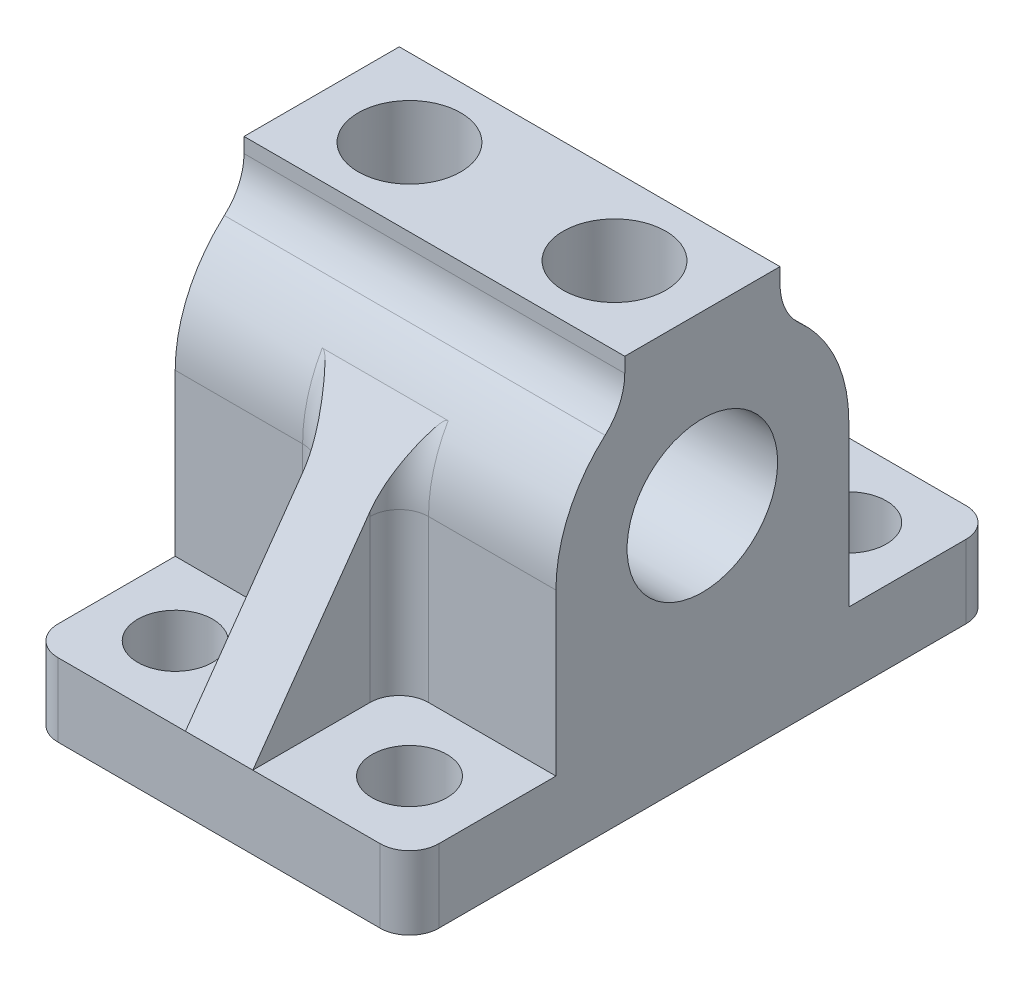
from build123d import *

# Parameters (mm, degrees)
SKETCH1_R           = 3.2639
BOSS_EXTRUDE1_DEPTH = 8.255
BOSS_EXTRUDE2_DEPTH = 1.4605
SKETCH3_R           = 1.6256
CUT_EXTRUDE1_DEPTH  = 21.180615699
CUT_EXTRUDE2_DEPTH  = 42.211451079
SKETCH6_W           = 16.51
SKETCH6_H           = 6.731
BOSS_EXTRUDE3_DEPTH = 1.905
SKETCH5_R           = 2.2225
CUT_EXTRUDE3_DEPTH  = 6.35
FILLET1_R           = 1.27
FILLET2_R           = 2.54


with BuildPart() as part:
    # Sketch1 → Boss-Extrude1 (new, symmetric)
    with BuildSketch(Plane(origin=(0, 0, 0), x_dir=(0, 0, -1), z_dir=(1, 0, 0))):
        with BuildLine():
            Line((12.7, 19.05), (-12.7, 19.05))
            Line((-12.7, 19.05), (-12.7, 22.225))
            Line((-12.7, 22.225), (-6.35, 22.225))
            Line((-6.35, 22.225), (-6.35, 29.21))
            ThreePointArc((-6.35, 29.21), (0, 35.56), (6.35, 29.21))
            Line((6.35, 29.21), (6.35, 22.225))
            Line((6.35, 22.225), (12.7, 22.225))
            Line((12.7, 22.225), (12.7, 19.05))
        make_face()
        with Locations((0, 29.21)):
            Circle(SKETCH1_R, mode=Mode.SUBTRACT)
    extrude(amount=BOSS_EXTRUDE1_DEPTH, both=True)

    # Sketch2 → Boss-Extrude2 (add, symmetric)
    with BuildSketch(Plane(origin=(0, 0, 0), x_dir=(0, 0, -1), z_dir=(1, 0, 0))):
        Polygon((-5.499261314, 32.385), (-12.7, 22.225), (-5.499261314, 22.225), align=None)
        Polygon((5.499261314, 22.225), (5.499261314, 32.385), (12.7, 22.225), align=None)
    extrude(amount=BOSS_EXTRUDE2_DEPTH, both=True)

    # Sketch3 → Cut-Extrude1 (cut, through all)
    with BuildSketch(Plane(origin=(0, 22.225, 0), x_dir=(1, 0, 0), z_dir=(0, 1, 0))):
        with Locations((-5.08, 9.525)):
            Circle(SKETCH3_R)
        with Locations((5.08, 9.525)):
            Circle(SKETCH3_R)
        with Locations((5.08, -9.525)):
            Circle(SKETCH3_R)
        with Locations((-5.08, -9.525)):
            Circle(SKETCH3_R)
    extrude(amount=-CUT_EXTRUDE1_DEPTH, mode=Mode.SUBTRACT)

    # Sketch4 → Cut-Extrude2 (cut, through all)
    with BuildSketch(Plane(origin=(8.255, 0, 0), x_dir=(0, 0, -1), z_dir=(1, 0, 0))):
        with BuildLine():
            Line((3.3655, 34.594785024), (-3.3655, 34.594785024))
            ThreePointArc((-3.3655, 34.594785024), (0, 35.56), (3.3655, 34.594785024))
        make_face()
    extrude(amount=-CUT_EXTRUDE2_DEPTH, mode=Mode.SUBTRACT)

    # Sketch6 → Boss-Extrude3 (add)
    with BuildSketch(Plane(origin=(0, 34.594785024, 0), x_dir=(1, 0, 0), z_dir=(0, 1, 0))):
        Rectangle(SKETCH6_W, SKETCH6_H)
    extrude(amount=BOSS_EXTRUDE3_DEPTH)

    # Sketch5 → Cut-Extrude3 (cut)
    with BuildSketch(Plane(origin=(0, 36.499785024, 0), x_dir=(1, 0, 0), z_dir=(0, 1, 0))):
        with Locations((-4.445, 0)):
            Circle(SKETCH5_R)
        with Locations((4.445, 0)):
            Circle(SKETCH5_R)
    extrude(amount=-CUT_EXTRUDE3_DEPTH, mode=Mode.SUBTRACT)

    # Fillet1
    fillet1_edges = [part.edges().sort_by_distance(p)[0] for p in [
        (-1.4605, 30.853500936, 6.133628997),
        (1.4605, 30.853500936, 6.133628997),
        (-1.4605, 30.853500936, -6.133628997),
        (1.4605, 30.853500936, -6.133628997),
        (-1.4605, 25.7175, 6.35),
        (1.4605, 25.7175, 6.35),
        (-1.4605, 25.7175, -6.35),
        (1.4605, 25.7175, -6.35),
        (-8.255, 20.6375, -12.7),
        (8.255, 20.6375, -12.7),
        (-8.255, 20.6375, 12.7),
        (8.255, 20.6375, 12.7),
    ]]
    fillet(fillet1_edges, radius=FILLET1_R)

    # Fillet2
    fillet2_edges = [part.edges().sort_by_distance(p)[0] for p in [
        (0, 34.594785024, -3.3655),
        (0, 34.594785024, 3.3655),
    ]]
    fillet(fillet2_edges, radius=FILLET2_R)


solid = part.part
